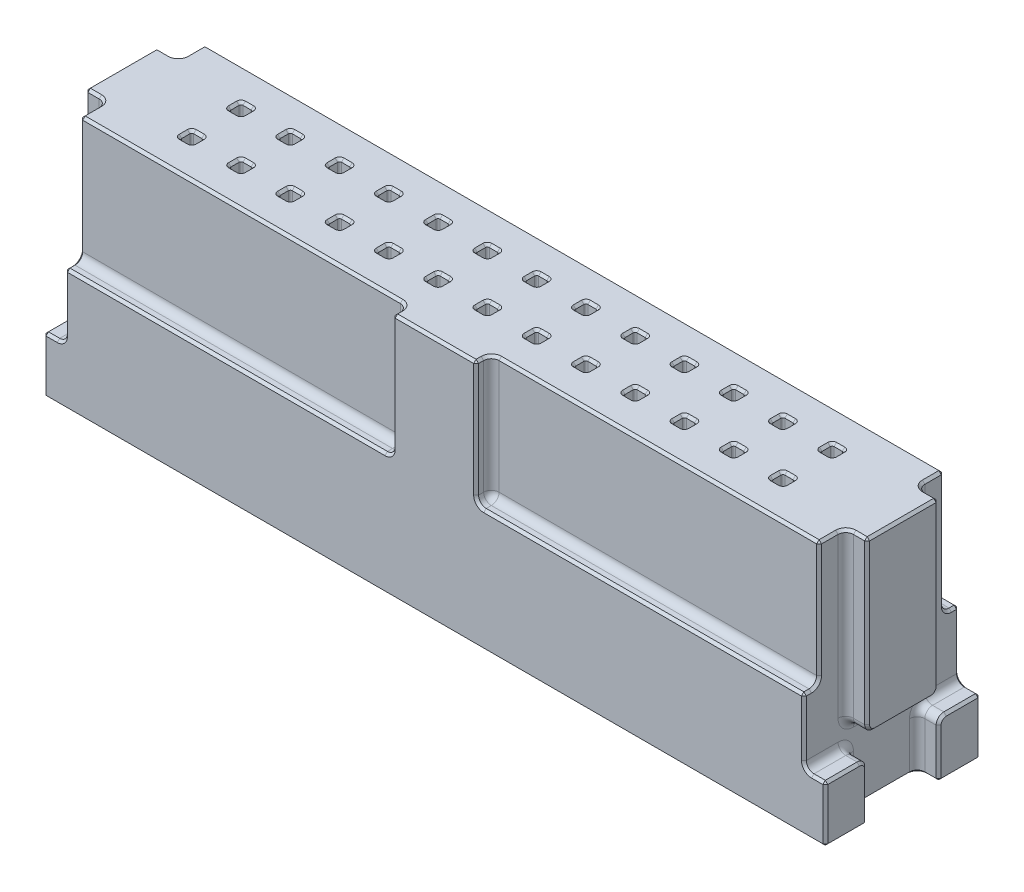
from build123d import *

# Parameters (mm, degrees)
SKETCH1_W            = 40.3098
SKETCH1_H            = 8.001
BOSS_EXTRUDE1_DEPTH  = 12.7
SKETCH2_W            = 1.1049
SKETCH2_H            = 2.159
CUT_EXTRUDE1_DEPTH   = 9.79932
CUT_EXTRUDE2_REACH   = 34.887
CUT_EXTRUDE2_START   = -8.73125
SKETCH4_W            = 1.1049
SKETCH4_H            = 3.683
SKETCH5_W            = 16.89989
SKETCH5_H            = 0.78613
SKETCH5_W_2          = 38.1
CUT_EXTRUDE3_DEPTH   = 6.4008
SKETCH6_W            = 0.61976
SKETCH6_H            = 0.61976
CUT_EXTRUDE4_DEPTH   = 6.10108
LPATTERN1_COUNT      = 13
LPATTERN1_PITCH      = 2.54
LPATTERN1_COUNT_DIR2 = 2
LPATTERN1_PITCH_DIR2 = 2.54
FILLET1_R            = 0.396875
FILLET3_R            = 0.09921875
CHAMFER1_SIZE        = 0.127


with BuildPart() as part:
    # Sketch1 → Boss-Extrude1 (new body)
    with BuildSketch(Plane(origin=(0, 0, 0), x_dir=(1, 0, 0), z_dir=(0, 1, 0))):
        Rectangle(SKETCH1_W, SKETCH1_H)
    extrude(amount=BOSS_EXTRUDE1_DEPTH)

    # Sketch2 → Cut-Extrude1 (cut)
    with BuildSketch(Plane(origin=(0, 12.7, 0), x_dir=(1, 0, 0), z_dir=(0, 1, 0))):
        with Locations((-19.60245, 2.921)):
            Rectangle(SKETCH2_W, SKETCH2_H)
        with Locations((-19.60245, -2.921)):
            Rectangle(SKETCH2_W, SKETCH2_H)
        with Locations((19.60245, 2.921)):
            Rectangle(SKETCH2_W, SKETCH2_H)
        with Locations((19.60245, -2.921)):
            Rectangle(SKETCH2_W, SKETCH2_H)
    extrude(amount=-CUT_EXTRUDE1_DEPTH, mode=Mode.SUBTRACT)

    # Sketch4 → Cut-Extrude2 (cut, up to next)
    with BuildSketch(Plane(origin=(0, 12.7, 0), x_dir=(1, 0, 0), z_dir=(0, 1, 0)).offset(CUT_EXTRUDE2_START), mode=Mode.PRIVATE) as cut_extrude2_sk1:
        with Locations((-19.60245, 0)):
            Rectangle(SKETCH4_W, SKETCH4_H)
    cut_extrude2_tool1 = extrude(cut_extrude2_sk1.sketch, amount=-CUT_EXTRUDE2_REACH, mode=Mode.PRIVATE) & part.part
    # Sketch4 → Cut-Extrude2 (cut, up to next)
    with BuildSketch(Plane(origin=(0, 12.7, 0), x_dir=(1, 0, 0), z_dir=(0, 1, 0)).offset(CUT_EXTRUDE2_START), mode=Mode.PRIVATE) as cut_extrude2_sk2:
        with Locations((19.60245, 0)):
            Rectangle(SKETCH4_W, SKETCH4_H)
    cut_extrude2_tool2 = extrude(cut_extrude2_sk2.sketch, amount=-CUT_EXTRUDE2_REACH, mode=Mode.PRIVATE) & part.part
    add(cut_extrude2_tool1.solids().sort_by_distance((-19.60245, 3.96875, 0))[0], mode=Mode.SUBTRACT)
    add(cut_extrude2_tool2.solids().sort_by_distance((19.60245, 3.96875, 0))[0], mode=Mode.SUBTRACT)

    # Sketch5 → Cut-Extrude3 (cut)
    with BuildSketch(Plane(origin=(0, 12.7, 0), x_dir=(1, 0, 0), z_dir=(0, 1, 0))):
        with Locations((-10.600055, -3.607435)):
            Rectangle(SKETCH5_W, SKETCH5_H)
        with Locations((10.600055, -3.607435)):
            Rectangle(SKETCH5_W, SKETCH5_H)
        with Locations((0, 3.607435)):
            Rectangle(SKETCH5_W_2, SKETCH5_H)
    extrude(amount=-CUT_EXTRUDE3_DEPTH, mode=Mode.SUBTRACT)

    # Sketch6 → Cut-Extrude4 (cut)
    with BuildSketch(Plane(origin=(0, 12.7, 0), x_dir=(1, 0, 0), z_dir=(0, 1, 0))):
        with Locations((-15.24, 1.27)):
            Rectangle(SKETCH6_W, SKETCH6_H)
    cut_extrude4 = extrude(amount=-CUT_EXTRUDE4_DEPTH, mode=Mode.SUBTRACT)

    # LPattern1: Cut-Extrude4 13 × 2
    with Locations(*[(i * LPATTERN1_PITCH, 0, j * LPATTERN1_PITCH_DIR2) for i in range(LPATTERN1_COUNT) for j in range(LPATTERN1_COUNT_DIR2) if (i, j) != (0, 0)]):
        add(cut_extrude4, mode=Mode.SUBTRACT)

    # Fillet1
    fillet1_edges = [part.edges().sort_by_distance(p)[0] for p in [
        (19.05, 8.334375, -1.8415),
        (19.05, 8.334375, 1.8415),
        (-19.05, 8.334375, 1.8415),
        (-19.05, 8.334375, -1.8415),
        (0, 6.2992, -3.21437),
        (-10.600055, 6.2992, 3.21437),
        (-2.15011, 6.2992, 3.607435),
        (-2.15011, 9.4996, 3.21437),
        (2.15011, 6.2992, 3.607435),
        (10.600055, 6.2992, 3.21437),
        (2.15011, 9.4996, 3.21437),
        (-19.05, 3.96875, 0),
        (19.05, 3.96875, 0),
        (-19.60245, 3.96875, 1.8415),
        (-19.60245, 3.96875, -1.8415),
        (-19.60245, 2.90068, -1.8415),
        (-19.60245, 2.90068, 1.8415),
        (19.60245, 3.96875, 1.8415),
        (19.60245, 3.96875, -1.8415),
        (19.60245, 2.90068, 1.8415),
        (19.60245, 2.90068, -1.8415),
        (19.05, 1.45034, -1.8415),
        (19.05, 2.90068, -2.921),
        (19.05, 1.45034, 1.8415),
        (19.05, 2.90068, 2.921),
        (-19.05, 2.90068, 2.921),
        (-19.05, 1.45034, 1.8415),
        (-19.05, 1.45034, -1.8415),
        (-19.05, 2.90068, -2.921),
    ]]
    fillet(fillet1_edges, radius=FILLET1_R)

    # Fillet3
    fillet3_edges = [part.edges().sort_by_distance(p)[0] for p in [
        (14.93012, 9.64946, 1.57988),
        (15.54988, 9.64946, 0.96012),
        (14.93012, 9.64946, 0.96012),
        (12.39012, 9.64946, 1.57988),
        (13.00988, 9.64946, 1.57988),
        (13.00988, 9.64946, 0.96012),
        (12.39012, 9.64946, 0.96012),
        (9.85012, 9.64946, 1.57988),
        (10.46988, 9.64946, 1.57988),
        (10.46988, 9.64946, 0.96012),
        (9.85012, 9.64946, 0.96012),
        (7.31012, 9.64946, 1.57988),
        (7.92988, 9.64946, 1.57988),
        (7.92988, 9.64946, 0.96012),
        (7.31012, 9.64946, 0.96012),
        (4.77012, 9.64946, 1.57988),
        (5.38988, 9.64946, 1.57988),
        (5.38988, 9.64946, 0.96012),
        (4.77012, 9.64946, 0.96012),
        (2.23012, 9.64946, 1.57988),
        (2.84988, 9.64946, 1.57988),
        (2.84988, 9.64946, 0.96012),
        (2.23012, 9.64946, 0.96012),
        (-0.30988, 9.64946, 1.57988),
        (0.30988, 9.64946, 1.57988),
        (0.30988, 9.64946, 0.96012),
        (-0.30988, 9.64946, 0.96012),
        (-2.84988, 9.64946, 1.57988),
        (-2.23012, 9.64946, 1.57988),
        (-2.23012, 9.64946, 0.96012),
        (-2.84988, 9.64946, 0.96012),
        (-5.38988, 9.64946, 1.57988),
        (-4.77012, 9.64946, 1.57988),
        (-4.77012, 9.64946, 0.96012),
        (-5.38988, 9.64946, 0.96012),
        (-7.92988, 9.64946, 1.57988),
        (-7.31012, 9.64946, 1.57988),
        (-7.31012, 9.64946, 0.96012),
        (-7.92988, 9.64946, 0.96012),
        (-10.46988, 9.64946, 1.57988),
        (-9.85012, 9.64946, 1.57988),
        (-9.85012, 9.64946, 0.96012),
        (-10.46988, 9.64946, 0.96012),
        (-13.00988, 9.64946, 1.57988),
        (-12.39012, 9.64946, 1.57988),
        (-12.39012, 9.64946, 0.96012),
        (-13.00988, 9.64946, 0.96012),
        (-15.54988, 9.64946, 1.57988),
        (-14.93012, 9.64946, 1.57988),
        (-14.93012, 9.64946, 0.96012),
        (-15.54988, 9.64946, 0.96012),
        (14.93012, 9.64946, -0.96012),
        (15.54988, 9.64946, -0.96012),
        (15.54988, 9.64946, -1.57988),
        (14.93012, 9.64946, -1.57988),
        (12.39012, 9.64946, -0.96012),
        (13.00988, 9.64946, -0.96012),
        (13.00988, 9.64946, -1.57988),
        (12.39012, 9.64946, -1.57988),
        (9.85012, 9.64946, -0.96012),
        (10.46988, 9.64946, -0.96012),
        (10.46988, 9.64946, -1.57988),
        (9.85012, 9.64946, -1.57988),
        (7.31012, 9.64946, -0.96012),
        (7.92988, 9.64946, -0.96012),
        (7.92988, 9.64946, -1.57988),
        (7.31012, 9.64946, -1.57988),
        (4.77012, 9.64946, -0.96012),
        (5.38988, 9.64946, -0.96012),
        (5.38988, 9.64946, -1.57988),
        (4.77012, 9.64946, -1.57988),
        (2.23012, 9.64946, -0.96012),
        (2.84988, 9.64946, -0.96012),
        (2.84988, 9.64946, -1.57988),
        (2.23012, 9.64946, -1.57988),
        (-0.30988, 9.64946, -0.96012),
        (0.30988, 9.64946, -0.96012),
        (0.30988, 9.64946, -1.57988),
        (-0.30988, 9.64946, -1.57988),
        (-2.84988, 9.64946, -0.96012),
        (-2.23012, 9.64946, -0.96012),
        (-2.23012, 9.64946, -1.57988),
        (-2.84988, 9.64946, -1.57988),
        (-5.38988, 9.64946, -0.96012),
        (-4.77012, 9.64946, -0.96012),
        (-4.77012, 9.64946, -1.57988),
        (-5.38988, 9.64946, -1.57988),
        (-7.92988, 9.64946, -0.96012),
        (-7.31012, 9.64946, -0.96012),
        (-7.31012, 9.64946, -1.57988),
        (-7.92988, 9.64946, -1.57988),
        (-10.46988, 9.64946, -0.96012),
        (-9.85012, 9.64946, -0.96012),
        (-9.85012, 9.64946, -1.57988),
        (-10.46988, 9.64946, -1.57988),
        (-13.00988, 9.64946, -0.96012),
        (-12.39012, 9.64946, -0.96012),
        (-12.39012, 9.64946, -1.57988),
        (-13.00988, 9.64946, -1.57988),
        (-15.54988, 9.64946, -0.96012),
        (-14.93012, 9.64946, -0.96012),
        (-14.93012, 9.64946, -1.57988),
        (-15.54988, 9.64946, -1.57988),
        (15.54988, 9.64946, 1.57988),
        (0, 6.59892, -1.57988),
        (0.30988, 6.59892, -1.27),
        (2.23012, 6.59892, -1.27),
        (2.54, 6.59892, -1.57988),
        (2.84988, 6.59892, -1.27),
        (2.54, 6.59892, -0.96012),
        (4.77012, 6.59892, -1.27),
        (5.08, 6.59892, -1.57988),
        (5.38988, 6.59892, -1.27),
        (5.08, 6.59892, -0.96012),
        (7.31012, 6.59892, -1.27),
        (7.62, 6.59892, -1.57988),
        (7.92988, 6.59892, -1.27),
        (7.62, 6.59892, -0.96012),
        (9.85012, 6.59892, -1.27),
        (10.16, 6.59892, -1.57988),
        (10.46988, 6.59892, -1.27),
        (10.16, 6.59892, -0.96012),
        (12.39012, 6.59892, -1.27),
        (12.7, 6.59892, -1.57988),
        (13.00988, 6.59892, -1.27),
        (12.7, 6.59892, -0.96012),
        (14.93012, 6.59892, -1.27),
        (15.24, 6.59892, -1.57988),
        (15.54988, 6.59892, -1.27),
        (15.24, 6.59892, -0.96012),
        (-15.54988, 6.59892, 1.27),
        (-15.24, 6.59892, 0.96012),
        (-14.93012, 6.59892, 1.27),
        (-15.24, 6.59892, 1.57988),
        (-13.00988, 6.59892, 1.27),
        (-12.7, 6.59892, 0.96012),
        (-12.39012, 6.59892, 1.27),
        (-12.7, 6.59892, 1.57988),
        (-10.46988, 6.59892, 1.27),
        (-10.16, 6.59892, 0.96012),
        (-9.85012, 6.59892, 1.27),
        (-10.16, 6.59892, 1.57988),
        (-7.92988, 6.59892, 1.27),
        (-7.62, 6.59892, 0.96012),
        (-7.31012, 6.59892, 1.27),
        (-7.62, 6.59892, 1.57988),
        (-5.38988, 6.59892, 1.27),
        (-5.08, 6.59892, 0.96012),
        (-4.77012, 6.59892, 1.27),
        (-5.08, 6.59892, 1.57988),
        (-2.84988, 6.59892, 1.27),
        (-2.54, 6.59892, 0.96012),
        (-2.23012, 6.59892, 1.27),
        (-2.54, 6.59892, 1.57988),
        (-0.30988, 6.59892, 1.27),
        (0, 6.59892, 0.96012),
        (0.30988, 6.59892, 1.27),
        (0, 6.59892, 1.57988),
        (2.23012, 6.59892, 1.27),
        (2.54, 6.59892, 0.96012),
        (2.84988, 6.59892, 1.27),
        (2.54, 6.59892, 1.57988),
        (4.77012, 6.59892, 1.27),
        (5.08, 6.59892, 0.96012),
        (5.38988, 6.59892, 1.27),
        (5.08, 6.59892, 1.57988),
        (7.31012, 6.59892, 1.27),
        (7.62, 6.59892, 0.96012),
        (7.92988, 6.59892, 1.27),
        (7.62, 6.59892, 1.57988),
        (9.85012, 6.59892, 1.27),
        (10.16, 6.59892, 0.96012),
        (10.46988, 6.59892, 1.27),
        (10.16, 6.59892, 1.57988),
        (12.39012, 6.59892, 1.27),
        (12.7, 6.59892, 0.96012),
        (13.00988, 6.59892, 1.27),
        (12.7, 6.59892, 1.57988),
        (14.93012, 6.59892, 1.27),
        (15.24, 6.59892, 0.96012),
        (15.54988, 6.59892, 1.27),
        (15.24, 6.59892, 1.57988),
        (-0.30988, 6.59892, -1.27),
        (0, 6.59892, -0.96012),
        (-2.54, 6.59892, -0.96012),
        (-2.23012, 6.59892, -1.27),
        (-2.54, 6.59892, -1.57988),
        (-2.84988, 6.59892, -1.27),
        (-5.08, 6.59892, -0.96012),
        (-4.77012, 6.59892, -1.27),
        (-5.08, 6.59892, -1.57988),
        (-5.38988, 6.59892, -1.27),
        (-7.62, 6.59892, -0.96012),
        (-7.31012, 6.59892, -1.27),
        (-7.62, 6.59892, -1.57988),
        (-7.92988, 6.59892, -1.27),
        (-10.16, 6.59892, -0.96012),
        (-9.85012, 6.59892, -1.27),
        (-10.16, 6.59892, -1.57988),
        (-10.46988, 6.59892, -1.27),
        (-12.7, 6.59892, -0.96012),
        (-12.39012, 6.59892, -1.27),
        (-12.7, 6.59892, -1.57988),
        (-13.00988, 6.59892, -1.27),
        (-14.93012, 6.59892, -1.27),
        (-15.24, 6.59892, -0.96012),
        (-15.54988, 6.59892, -1.27),
        (-15.24, 6.59892, -1.57988),
    ]]
    fillet(fillet3_edges, radius=FILLET3_R)

    # Chamfer1
    chamfer1_edges = [part.edges().sort_by_distance(p)[0] for p in [
        (15.520819501, 12.7, 1.550819501),
        (15.54988, 12.7, 1.27),
        (15.520819501, 12.7, 0.989180499),
        (15.24, 12.7, 0.96012),
        (14.959180499, 12.7, 0.989180499),
        (14.93012, 12.7, 1.27),
        (14.959180499, 12.7, 1.550819501),
        (15.24, 12.7, 1.57988),
        (12.980819501, 12.7, 1.550819501),
        (13.00988, 12.7, 1.27),
        (12.980819501, 12.7, 0.989180499),
        (12.7, 12.7, 0.96012),
        (12.419180499, 12.7, 0.989180499),
        (12.39012, 12.7, 1.27),
        (12.419180499, 12.7, 1.550819501),
        (12.7, 12.7, 1.57988),
        (10.440819501, 12.7, 1.550819501),
        (10.46988, 12.7, 1.27),
        (10.440819501, 12.7, 0.989180499),
        (10.16, 12.7, 0.96012),
        (9.879180499, 12.7, 0.989180499),
        (9.85012, 12.7, 1.27),
        (9.879180499, 12.7, 1.550819501),
        (10.16, 12.7, 1.57988),
        (7.900819501, 12.7, 1.550819501),
        (7.92988, 12.7, 1.27),
        (7.900819501, 12.7, 0.989180499),
        (7.62, 12.7, 0.96012),
        (7.339180499, 12.7, 0.989180499),
        (7.31012, 12.7, 1.27),
        (7.339180499, 12.7, 1.550819501),
        (7.62, 12.7, 1.57988),
        (5.360819501, 12.7, 1.550819501),
        (5.38988, 12.7, 1.27),
        (5.360819501, 12.7, 0.989180499),
        (5.08, 12.7, 0.96012),
        (4.799180499, 12.7, 0.989180499),
        (4.77012, 12.7, 1.27),
        (4.799180499, 12.7, 1.550819501),
        (5.08, 12.7, 1.57988),
        (2.820819501, 12.7, 1.550819501),
        (2.84988, 12.7, 1.27),
        (2.820819501, 12.7, 0.989180499),
        (2.54, 12.7, 0.96012),
        (2.259180499, 12.7, 0.989180499),
        (2.23012, 12.7, 1.27),
        (2.259180499, 12.7, 1.550819501),
        (2.54, 12.7, 1.57988),
        (0.280819501, 12.7, 1.550819501),
        (0.30988, 12.7, 1.27),
        (0.280819501, 12.7, 0.989180499),
        (0, 12.7, 0.96012),
        (-0.280819501, 12.7, 0.989180499),
        (-0.30988, 12.7, 1.27),
        (-0.280819501, 12.7, 1.550819501),
        (0, 12.7, 1.57988),
        (-2.259180499, 12.7, 1.550819501),
        (-2.23012, 12.7, 1.27),
        (-2.259180499, 12.7, 0.989180499),
        (-2.54, 12.7, 0.96012),
        (-2.820819501, 12.7, 0.989180499),
        (-2.84988, 12.7, 1.27),
        (-2.820819501, 12.7, 1.550819501),
        (-2.54, 12.7, 1.57988),
        (-4.799180499, 12.7, 1.550819501),
        (-4.77012, 12.7, 1.27),
        (-4.799180499, 12.7, 0.989180499),
        (-5.08, 12.7, 0.96012),
        (-5.360819501, 12.7, 0.989180499),
        (-5.38988, 12.7, 1.27),
        (-5.360819501, 12.7, 1.550819501),
        (-5.08, 12.7, 1.57988),
        (-7.339180499, 12.7, 1.550819501),
        (-7.31012, 12.7, 1.27),
        (-7.339180499, 12.7, 0.989180499),
        (-7.62, 12.7, 0.96012),
        (-7.900819501, 12.7, 0.989180499),
        (-7.92988, 12.7, 1.27),
        (-7.900819501, 12.7, 1.550819501),
        (-7.62, 12.7, 1.57988),
        (-9.879180499, 12.7, 1.550819501),
        (-9.85012, 12.7, 1.27),
        (-9.879180499, 12.7, 0.989180499),
        (-10.16, 12.7, 0.96012),
        (-10.440819501, 12.7, 0.989180499),
        (-10.46988, 12.7, 1.27),
        (-10.440819501, 12.7, 1.550819501),
        (-10.16, 12.7, 1.57988),
        (-12.419180499, 12.7, 1.550819501),
        (-12.39012, 12.7, 1.27),
        (-12.419180499, 12.7, 0.989180499),
        (-12.7, 12.7, 0.96012),
        (-12.980819501, 12.7, 0.989180499),
        (-13.00988, 12.7, 1.27),
        (-12.980819501, 12.7, 1.550819501),
        (-12.7, 12.7, 1.57988),
        (-14.959180499, 12.7, 1.550819501),
        (-14.93012, 12.7, 1.27),
        (-14.959180499, 12.7, 0.989180499),
        (-15.24, 12.7, 0.96012),
        (-15.520819501, 12.7, 0.989180499),
        (-15.54988, 12.7, 1.27),
        (-15.520819501, 12.7, 1.550819501),
        (-15.24, 12.7, 1.57988),
        (15.520819501, 12.7, -0.989180499),
        (15.54988, 12.7, -1.27),
        (15.520819501, 12.7, -1.550819501),
        (15.24, 12.7, -1.57988),
        (14.959180499, 12.7, -1.550819501),
        (14.93012, 12.7, -1.27),
        (14.959180499, 12.7, -0.989180499),
        (15.24, 12.7, -0.96012),
        (12.980819501, 12.7, -0.989180499),
        (13.00988, 12.7, -1.27),
        (12.980819501, 12.7, -1.550819501),
        (12.7, 12.7, -1.57988),
        (12.419180499, 12.7, -1.550819501),
        (12.39012, 12.7, -1.27),
        (12.419180499, 12.7, -0.989180499),
        (12.7, 12.7, -0.96012),
        (10.440819501, 12.7, -0.989180499),
        (10.46988, 12.7, -1.27),
        (10.440819501, 12.7, -1.550819501),
        (10.16, 12.7, -1.57988),
        (9.879180499, 12.7, -1.550819501),
        (9.85012, 12.7, -1.27),
        (9.879180499, 12.7, -0.989180499),
        (10.16, 12.7, -0.96012),
        (7.900819501, 12.7, -0.989180499),
        (7.92988, 12.7, -1.27),
        (7.900819501, 12.7, -1.550819501),
        (7.62, 12.7, -1.57988),
        (7.339180499, 12.7, -1.550819501),
        (7.31012, 12.7, -1.27),
        (7.339180499, 12.7, -0.989180499),
        (7.62, 12.7, -0.96012),
        (5.360819501, 12.7, -0.989180499),
        (5.38988, 12.7, -1.27),
        (5.360819501, 12.7, -1.550819501),
        (5.08, 12.7, -1.57988),
        (4.799180499, 12.7, -1.550819501),
        (4.77012, 12.7, -1.27),
        (4.799180499, 12.7, -0.989180499),
        (5.08, 12.7, -0.96012),
        (2.820819501, 12.7, -0.989180499),
        (2.84988, 12.7, -1.27),
        (2.820819501, 12.7, -1.550819501),
        (2.54, 12.7, -1.57988),
        (2.259180499, 12.7, -1.550819501),
        (2.23012, 12.7, -1.27),
        (2.259180499, 12.7, -0.989180499),
        (2.54, 12.7, -0.96012),
        (0.280819501, 12.7, -0.989180499),
        (0.30988, 12.7, -1.27),
        (0.280819501, 12.7, -1.550819501),
        (0, 12.7, -1.57988),
        (-0.280819501, 12.7, -1.550819501),
        (-0.30988, 12.7, -1.27),
        (-0.280819501, 12.7, -0.989180499),
        (0, 12.7, -0.96012),
        (-2.259180499, 12.7, -0.989180499),
        (-2.23012, 12.7, -1.27),
        (-2.259180499, 12.7, -1.550819501),
        (-2.54, 12.7, -1.57988),
        (-2.820819501, 12.7, -1.550819501),
        (-2.84988, 12.7, -1.27),
        (-2.820819501, 12.7, -0.989180499),
        (-2.54, 12.7, -0.96012),
        (-4.799180499, 12.7, -0.989180499),
        (-4.77012, 12.7, -1.27),
        (-4.799180499, 12.7, -1.550819501),
        (-5.08, 12.7, -1.57988),
        (-5.360819501, 12.7, -1.550819501),
        (-5.38988, 12.7, -1.27),
        (-5.360819501, 12.7, -0.989180499),
        (-5.08, 12.7, -0.96012),
        (-7.339180499, 12.7, -0.989180499),
        (-7.31012, 12.7, -1.27),
        (-7.339180499, 12.7, -1.550819501),
        (-7.62, 12.7, -1.57988),
        (-7.900819501, 12.7, -1.550819501),
        (-7.92988, 12.7, -1.27),
        (-7.900819501, 12.7, -0.989180499),
        (-7.62, 12.7, -0.96012),
        (-9.879180499, 12.7, -0.989180499),
        (-9.85012, 12.7, -1.27),
        (-9.879180499, 12.7, -1.550819501),
        (-10.16, 12.7, -1.57988),
        (-10.440819501, 12.7, -1.550819501),
        (-10.46988, 12.7, -1.27),
        (-10.440819501, 12.7, -0.989180499),
        (-10.16, 12.7, -0.96012),
        (-12.419180499, 12.7, -0.989180499),
        (-12.39012, 12.7, -1.27),
        (-12.419180499, 12.7, -1.550819501),
        (-12.7, 12.7, -1.57988),
        (-12.980819501, 12.7, -1.550819501),
        (-13.00988, 12.7, -1.27),
        (-12.980819501, 12.7, -0.989180499),
        (-12.7, 12.7, -0.96012),
        (-19.05, 6.2992, -3.8058725),
        (19.05, 6.2992, -3.8058725),
        (-19.05, 6.2992, 3.8058725),
        (19.05, 6.2992, 3.8058725),
        (-19.05, 6.415441996, -3.330611996),
        (19.05, 6.415441996, -3.330611996),
        (-19.05, 6.415441996, 3.330611996),
        (19.05, 6.415441996, 3.330611996),
        (-19.166241996, 0, 1.725258004),
        (-19.8008875, 0, 1.8415),
        (-19.05, 0, 0),
        (-19.166241996, 0, -1.725258004),
        (-19.8008875, 0, -1.8415),
        (20.1549, 0, -2.921),
        (-20.1549, 0, -2.921),
        (-20.1549, 1.2519025, -1.8415),
        (-20.1549, 2.784438004, -1.957741996),
        (-20.1549, 2.90068, -3.1194375),
        (-20.1549, 1.45034, -4.0005),
        (0, 0, -4.0005),
        (20.1549, 1.45034, -4.0005),
        (-19.8008875, 2.90068, -4.0005),
        (-19.166241996, 3.016921996, -4.0005),
        (-19.05, 4.7983775, -4.0005),
        (0, 6.2992, -4.0005),
        (19.05, 4.7983775, -4.0005),
        (19.166241996, 3.016921996, -4.0005),
        (19.8008875, 2.90068, -4.0005),
        (20.1549, 2.90068, -3.1194375),
        (20.1549, 2.784438004, -1.957741996),
        (20.1549, 1.2519025, -1.8415),
        (19.8008875, 0, -1.8415),
        (19.166241996, 0, -1.725258004),
        (19.05, 0, 0),
        (19.166241996, 0, 1.725258004),
        (19.8008875, 0, 1.8415),
        (-19.05, 9.6980375, -3.21437),
        (19.05, 9.6980375, -3.21437),
        (-19.05, 9.6980375, 3.21437),
        (20.1549, 0, 2.921),
        (20.1549, 1.2519025, 1.8415),
        (20.1549, 2.784438004, 1.957741996),
        (20.1549, 2.90068, 3.1194375),
        (19.05, 9.6980375, 3.21437),
        (-20.1549, 0, 2.921),
        (-20.1549, 1.2519025, 1.8415),
        (-20.1549, 2.784438004, 1.957741996),
        (-20.1549, 2.90068, 3.1194375),
        (20.1549, 8.5328125, -1.8415),
        (20.1549, 4.084991996, -1.725258004),
        (20.1549, 3.96875, 0),
        (20.1549, 4.084991996, 1.725258004),
        (20.1549, 8.5328125, 1.8415),
        (19.05, 4.7983775, 4.0005),
        (19.166241996, 3.016921996, 4.0005),
        (19.8008875, 2.90068, 4.0005),
        (20.1549, 1.45034, 4.0005),
        (0, 0, 4.0005),
        (-20.1549, 1.45034, 4.0005),
        (-19.8008875, 2.90068, 4.0005),
        (-19.166241996, 3.016921996, 4.0005),
        (-19.05, 4.7983775, 4.0005),
        (-10.7984925, 6.2992, 4.0005),
        (-2.266351996, 6.415441996, 4.0005),
        (-2.15011, 9.6980375, 4.0005),
        (10.7984925, 6.2992, 4.0005),
        (2.266351996, 6.415441996, 4.0005),
        (2.15011, 9.6980375, 4.0005),
        (-20.1549, 4.084991996, -1.725258004),
        (-20.1549, 8.5328125, -1.8415),
        (-20.1549, 3.96875, 0),
        (-20.1549, 4.084991996, 1.725258004),
        (-20.1549, 8.5328125, 1.8415),
        (19.166241996, 12.7, -1.957741996),
        (19.8008875, 12.7, -1.8415),
        (20.1549, 12.7, 0),
        (19.8008875, 12.7, 1.8415),
        (19.166241996, 12.7, 1.957741996),
        (19.05, 12.7, 2.7263725),
        (10.7984925, 12.7, 3.21437),
        (2.266351996, 12.7, 3.330611996),
        (2.15011, 12.7, 3.8058725),
        (0, 12.7, 4.0005),
        (-2.15011, 12.7, 3.8058725),
        (-2.266351996, 12.7, 3.330611996),
        (-10.7984925, 12.7, 3.21437),
        (-19.05, 12.7, 2.7263725),
        (-19.166241996, 12.7, 1.957741996),
        (-19.8008875, 12.7, 1.8415),
        (-20.1549, 12.7, 0),
        (-19.8008875, 12.7, -1.8415),
        (-19.166241996, 12.7, -1.957741996),
        (-19.05, 12.7, -2.7263725),
        (0, 12.7, -3.21437),
        (19.05, 12.7, -2.7263725),
        (-14.959180499, 12.7, -0.989180499),
        (-14.93012, 12.7, -1.27),
        (-14.959180499, 12.7, -1.550819501),
        (-15.24, 12.7, -1.57988),
        (-15.520819501, 12.7, -1.550819501),
        (-15.54988, 12.7, -1.27),
        (-15.520819501, 12.7, -0.989180499),
        (-15.24, 12.7, -0.96012),
    ]]
    chamfer(chamfer1_edges, length=CHAMFER1_SIZE)


solid = part.part
